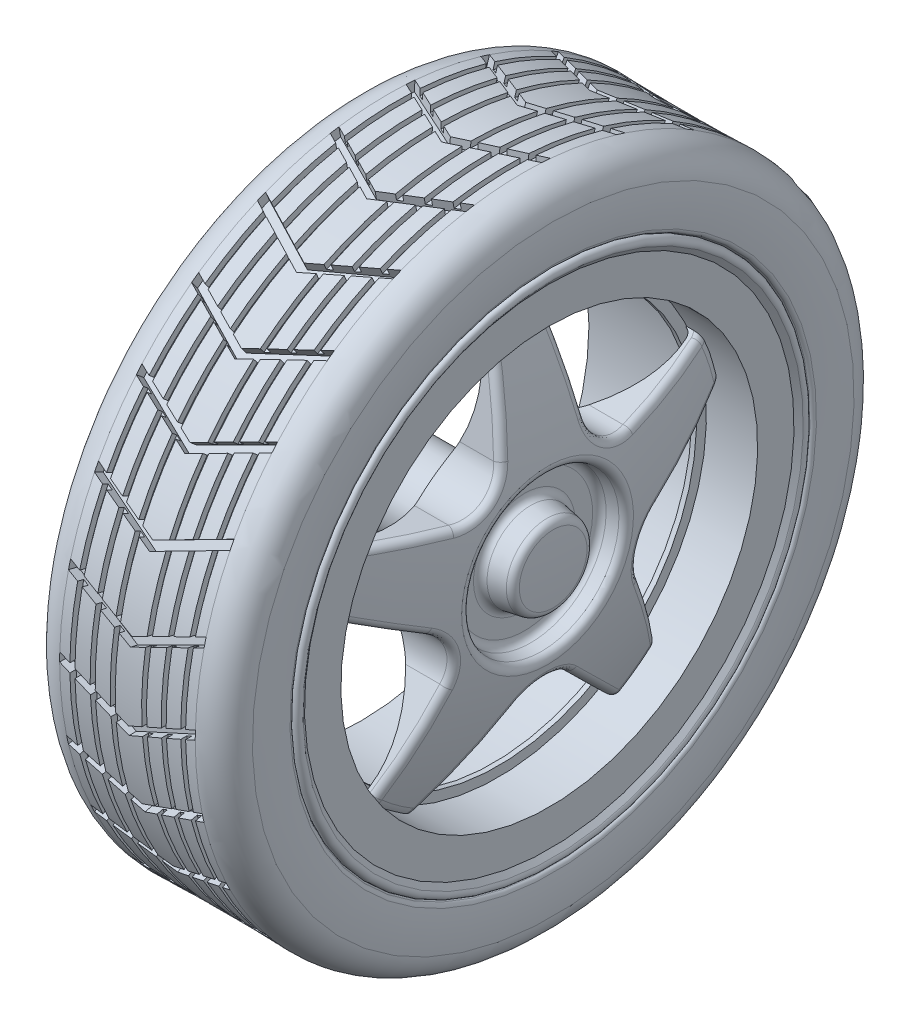
from build123d import *

# Parameters (mm, degrees)
CORTAR_EXTRUIR1_START = 28.999999999999996
CORTAR_EXTRUIR1_DEPTH = 28.999999999999996
MATRIZC1_COUNT        = 5
REDONDEO1_R           = 0.75
REDONDEO2_R           = 0.75
CORTAR_EXTRUIR2_DEPTH = 10
CUT_EXTRUDE1_DEPTH    = 1
CIRPATTERN1_COUNT     = 27


# Read off the part's stored shape, not the designer's step: Cortar-Revolución4
with BuildPart() as part:
    # Croquis1 → Revolución1 (revolve)
    with BuildSketch(Plane.XY):
        with BuildLine():
            Line((2.5, 24.999999999999996), (0.7352941176470583, 25.941176470588232))
            ThreePointArc((0.7352941176470585, 25.941176470588232), (0.12020814131487328, 25.825204772530324), (0.100301875811656, 25.199597920246344))
            Line((0.10030187581165524, 25.199597920246344), (0.5, 24.667782059947733))
            Line((0.5, 24.667782059947733), (0.5000000000000004, 20.999999999999996))
            Line((0.5000000000000004, 20.999999999999996), (13.83221794005226, 20.999999999999996))
            Line((13.83221794005226, 20.999999999999996), (15.83221794005226, 20.999999999999996))
            Line((15.83221794005226, 20.999999999999996), (19.5, 20.999999999999996))
            Line((19.5, 20.999999999999996), (19.5, 24.667782059947736))
            Line((19.5, 24.667782059947736), (19.899698124188344, 25.19959792024635))
            ThreePointArc((19.899698124188347, 25.19959792024635), (19.879791858685124, 25.825204772530324), (19.264705882352946, 25.941176470588236))
            Line((19.264705882352946, 25.941176470588236), (17.499999999999996, 25))
            Line((17.499999999999996, 25), (2.5, 24.999999999999996))
        make_face()
    revolve(axis=Axis((20, 0, 0), (-1, -1.2e-16, 0)))


with BuildPart() as body_2:
    # Croquis1<3> → Revolución2 (revolve)
    with BuildSketch(Plane.XY):
        with BuildLine():
            ThreePointArc((15.229709414249836, 20.044993192200682), (14.678536500553854, 20.73844454625571), (13.83221794005226, 20.999999999999996))
            Line((13.83221794005226, 20.999999999999996), (15.83221794005226, 20.999999999999996))
            ThreePointArc((15.83221794005226, 20.999999999999996), (16.01691722525036, 20.715355517227323), (16.161370397048206, 20.408321987001138))
            ThreePointArc((16.161370397048206, 20.408321987001138), (18.159269913999402, 14.261864726586808), (19.437899090853012, 7.926594664305913))
            Line((19.437899090853012, 7.926594664305913), (17.000000000000004, 7.5))
            Line((17.000000000000004, 7.5), (16.999999999999996, 4.500000000000001))
            Line((16.999999999999996, 4.500000000000001), (19.857395198343077, 4))
            ThreePointArc((19.857395198343077, 4), (19.96433747853814, 2.0012706044820376), (20, 0))
            Line((20, 0), (-4.999999999999995, -3.06e-15))
            Line((-4.999999999999995, -3.06e-15), (-4.999999999999994, 4))
            Line((-4.999999999999994, 4), (7.41803141324657, 6.172963582434665))
            ThreePointArc((7.41803141324657, 6.172963582434665), (14.609153979008614, 11.25895513363789), (15.229709414249836, 20.044993192200682))
        make_face()
    revolve(axis=Axis((20, 0, 0), (-1, -1.2e-16, 0)))

    # Croquis2 → Cortar-Extruir1 (cut)
    with BuildSketch(Plane(origin=(0, 0, 0), x_dir=(0, 0, -1), z_dir=(1, 0, 0)).offset(CORTAR_EXTRUIR1_START)):
        with BuildLine():
            ThreePointArc((-19.032482471529132, 8.874942871418174), (-12.343490298141932, 16.989356881873892), (-2.5592117207636766, 20.843474647196086))
            Line((-2.5592117207636766, 20.843474647196086), (-4.238740146298038, 10.618509398268122))
            ThreePointArc((-4.238740146298038, 10.618509398268122), (-5.834705949164168, 8.030783779695161), (-8.788959816618782, 7.312581296013566))
            Line((-8.788959816618782, 7.312581296013566), (-19.032482471529132, 8.874942871418174))
        make_face()
    cortar_extruir1 = extrude(amount=-CORTAR_EXTRUIR1_DEPTH, mode=Mode.SUBTRACT)

    # MatrizC1: Cortar-Extruir1 ×5 about axis
    matrizc1_axis = Axis((0, 1.5e-15, -3.8e-16), (1, 0, 0))
    for i in range(1, MATRIZC1_COUNT):
        add(cortar_extruir1.rotate(matrizc1_axis, i * 360 / MATRIZC1_COUNT), mode=Mode.SUBTRACT)


with BuildPart() as cortar_revoluci_n1_tool:
    # Croquis3 → Cortar-Revolución1 (revolve)
    with BuildSketch(Plane.XY):
        Polygon((14.332217940052262, 19.499999999999996), (14.332217940052264, 22.499999999999993), (14.332217940052264, 22.999999999999993), (13.83221794005226, 22.999999999999993), (13.83221794005226, 20.999999999999996), (13.83221794005226, 19.499999999999996), align=None)
        Polygon((13.83221794005226, 20.999999999999996), (13.83221794005226, 22.999999999999993), (-1.1677820599477382, 22.999999999999986), (-1.1677820599477386, 20.999999999999982), align=None)
    revolve(axis=Axis((7.418031413246568, -1.54e-15, 0), (-1, -1.2e-16, 0)))


with BuildPart() as part_1:
    add(part.part)

    # Cortar-Revolución1: cut by cortar_revoluci_n1_tool
    add(cortar_revoluci_n1_tool.part, mode=Mode.SUBTRACT)

    # Croquis4 → Revolución3 (revolve)
    with BuildSketch(Plane.XY):
        with BuildLine():
            Line((14.332217940052264, 22.999999999999993), (13.832217940052262, 22.999999999999993))
            Line((13.832217940052262, 22.999999999999993), (12.332217940052265, 22.999999999999996))
            ThreePointArc((12.332217940052265, 22.999999999999996), (13.392878111832086, 22.56066017177982), (13.832217940052262, 21.499999999999996))
            Line((13.832217940052262, 21.499999999999996), (13.832217940052262, 19.999999999999996))
            Line((13.832217940052262, 19.999999999999996), (14.332217940052264, 19.999999999999996))
            Line((14.332217940052264, 19.999999999999996), (14.332217940052264, 22.999999999999993))
        make_face()
    revolve(axis=Axis((7.418031413246568, -1.54e-15, 0), (-1, -1.2e-16, 0)))


with BuildPart() as body_2_1:
    add(body_2.part)

    # Cortar-Revolución1: cut by cortar_revoluci_n1_tool
    add(cortar_revoluci_n1_tool.part, mode=Mode.SUBTRACT)

    # Redondeo1
    redondeo1_edges = [body_2_1.edges().sort_by_distance(p)[0] for p in [
        (16.017390352561375, -18.157716094822753, -9.969355513847564),
        (17.713468801645313, -14.549912860999985, -6.320010510851247),
        (19.115914274162588, -9.926594664307888, -2.471356e-11),
        (16.017390352561375, -18.157716094822757, 9.969355513847558),
        (17.713468801645313, -14.549912860999985, 6.320010510851239),
        (17.000000000000004, -7.5, -4.25e-15),
        (16.01739035256137, -15.09246337704348, 14.188313936274088),
        (17.713468801645327, -10.506857520122566, 11.884798785499381),
        (19.11591427416263, -3.067486447566317, 9.44075254010308),
        (16.017390352561375, 3.870377672372002, 20.349714489763052),
        (17.713468801645355, 1.514516838675414, 15.79078009046219),
        (16.999999999999996, -4.500000000000001, -5.5e-16),
        (19.857395198343077, -4, -4.9e-16),
        (19.11591427416269, 8.030783779682231, 5.834705949185325),
        (16.01739035256137, 20.54974104564736, 2.607459702182234),
        (17.713468801645412, 15.485935743835702, 3.4392282939293777),
        (16.01739035256137, 8.830060753846865, 18.738215769518757),
        (17.71346880164539, 8.056317798611854, 13.665220109743553),
        (16.01739035256137, 20.54974104564736, -2.607459702182232),
        (17.713468801645405, 15.485935743835707, -3.439228293929376),
        (19.11591427416269, 8.030783779711285, -5.834705949145338),
        (16.01739035256137, 8.830060753846867, -18.738215769518757),
        (17.71346880164539, 8.056317798611854, -13.665220109743546),
        (16.01739035256137, 3.870377672372008, -20.349714489763052),
        (17.713468801645355, 1.5145168386754158, -15.790780090462187),
        (19.115914274162627, -3.0674864475193098, -9.440752540118355),
        (16.017390352561375, -15.092463377043474, -14.18831393627409),
        (17.713468801645327, -10.506857520122566, -11.884798785499385),
    ]]
    fillet(redondeo1_edges, radius=REDONDEO1_R)

    # Cortar-Revolución4 outline → Cortar-Revolución4 (revolve, cut)
    with BuildSketch(Plane.YX):
        Polygon((4, -5), (6.172963582, 7.418031413), (10.776802277, 7.418031413), (10.776802277, 14.320012605), (4, 10), align=None)
    revolve(axis=Axis((0, 0, 0), (1, 0, 0)), mode=Mode.SUBTRACT)

    # Redondeo2
    redondeo2_edges = [body_2_1.edges().sort_by_distance(p)[0] for p in [
        (19.437899090853016, -7.926594664305911, -9.7e-16),
    ]]
    fillet(redondeo2_edges, radius=REDONDEO2_R)

    # Croquis8 → Cortar-Extruir2 (cut)
    with BuildSketch(Plane.ZY.offset(4.999999999999994)):
        with BuildLine():
            Line((-1.7999999999999998, 2.012461179749811), (-1.7999999999999998, -2.012461179749811))
            ThreePointArc((-1.7999999999999998, -2.012461179749811), (3.8e-16, -2.6999999999999966), (1.8000000000000003, -2.012461179749811))
            Line((1.8000000000000003, -2.012461179749811), (1.8000000000000003, 2.012461179749811))
            ThreePointArc((1.8000000000000003, 2.012461179749811), (3.8e-16, 2.6999999999999993), (-1.7999999999999998, 2.012461179749811))
        make_face()
    extrude(amount=-CORTAR_EXTRUIR2_DEPTH, mode=Mode.SUBTRACT)


with BuildPart() as body_3:
    # Croquis7 → Revolución4 (revolve)
    with BuildSketch(Plane.XY):
        with BuildLine():
            Line((17.499999999999996, 25), (19.63807526131374, 26.14030680603399))
            ThreePointArc((19.63807526131374, 26.14030680603399), (19.817364623189437, 26.301982760510352), (19.89999999999999, 26.528820112013612))
            ThreePointArc((19.89999999999999, 26.528820112013612), (20.000000000000007, 28.42239954983263), (19.900000000000006, 30.31597898765165))
            ThreePointArc((19.900000000000006, 30.31597898765165), (18.890733550231978, 32.2590129863905), (16.829958256010144, 32.998746096104654))
            ThreePointArc((16.829958256010144, 32.99874609610467), (16.32997244234885, 32.98481539095249), (15.829958256010155, 32.97194325559613))
            Line((15.829958256010153, 32.97194325559619), (15.829958256010153, 32.34040523977073))
            Line((15.829958256010153, 32.34040523977073), (15.329958256010151, 32.34040523977073))
            Line((15.329958256010151, 32.34040523977073), (15.329958256010151, 32.96013065754638))
            ThreePointArc((15.329958256010151, 32.96013065754633), (14.579981342967638, 32.94439778392433), (13.829958256010151, 32.93104628812981))
            Line((13.829958256010151, 32.93104628812984), (13.829958256010151, 32.30374345422145))
            Line((13.829958256010151, 32.30374345422145), (13.329958256010151, 32.30374345422145))
            Line((13.329958256010151, 32.30374345422145), (13.32995825601015, 32.923468871997095))
            ThreePointArc((13.32995825601015, 32.92346887199702), (12.579971257897885, 32.914087559074005), (11.829958256010153, 32.90708731843816))
            Line((11.829958256010151, 32.90708731843822), (11.829958256010151, 32.30374345422145))
            Line((11.829958256010151, 32.30374345422145), (11.329958256010151, 32.30374345422145))
            Line((11.329958256010151, 32.30374345422145), (11.329958256010151, 32.903743454221505))
            ThreePointArc((11.329958256010155, 32.903743454221456), (9.999999999999998, 32.89999999999998), (8.670041743989845, 32.9037434542214))
            Line((8.670041743989845, 32.903743454221505), (8.670041743989845, 32.30374345422145))
            Line((8.670041743989845, 32.30374345422145), (8.170041743989845, 32.30374345422145))
            Line((8.170041743989845, 32.30374345422145), (8.170041743989845, 32.90708731843822))
            ThreePointArc((8.170041743989845, 32.90708731843819), (7.4200287421021125, 32.914087559074005), (6.670041743989845, 32.92346887199707))
            Line((6.670041743989846, 32.923468871997095), (6.670041743989845, 32.30374345422145))
            Line((6.670041743989845, 32.30374345422145), (6.170041743989845, 32.30374345422145))
            Line((6.170041743989845, 32.30374345422145), (6.170041743989847, 32.93104628812984))
            ThreePointArc((6.170041743989846, 32.93104628812981), (5.42001865703236, 32.9443977839243), (4.670041743989845, 32.96013065754633))
            Line((4.670041743989846, 32.96013065754638), (4.670041743989845, 32.34040523977073))
            Line((4.670041743989845, 32.34040523977073), (4.170041743989845, 32.34040523977073))
            Line((4.170041743989845, 32.34040523977073), (4.170041743989846, 32.97194325559619))
            ThreePointArc((4.170041743989845, 32.97194325559613), (3.6700275576511503, 32.98481539095252), (3.1700417439898585, 32.99874609610467))
            ThreePointArc((3.1700417439898576, 32.998746096104654), (1.1092664497680234, 32.25901298639049), (0.09999999999999876, 30.315978987651633))
            ThreePointArc((0.10000000000000142, 30.315978987651633), (7.11e-15, 28.42239954983263), (0.09999999999999787, 26.528820112013626))
            ThreePointArc((0.10000000000000014, 26.528820112013626), (0.18263537681055303, 26.30198276051036), (0.36192473868625186, 26.140306806033994))
            Line((0.36192473868625213, 26.140306806033994), (2.5, 24.999999999999996))
            Line((2.5, 24.999999999999996), (17.499999999999996, 25))
        make_face()
    revolve(axis=Axis((20, 0, 0), (-1, -1.2e-16, 0)))

    # Sketch2 → Cut-Extrude1 (cut)
    with BuildSketch(Plane.XY.offset(33)):
        Polygon((3.170041743989792, 0), (9.909175165933616, -3.1705519940930587), (16.829958256010148, 0), (16.829958256010148, 0.8818758599609261), (9.909175165933616, -2.288676134132132), (3.170041743989792, 0.8818758599609261), align=None)
    cut_extrude1 = extrude(amount=-CUT_EXTRUDE1_DEPTH, mode=Mode.SUBTRACT)

    # CirPattern1: Cut-Extrude1 ×27 about axis
    cirpattern1_axis = Axis((0, 4e-16, -1.38e-15), (1, 0, 0))
    for i in range(1, CIRPATTERN1_COUNT):
        add(cut_extrude1.rotate(cirpattern1_axis, i * 360 / CIRPATTERN1_COUNT), mode=Mode.SUBTRACT)


solid = Compound([part_1.part, body_2_1.part, body_3.part])
